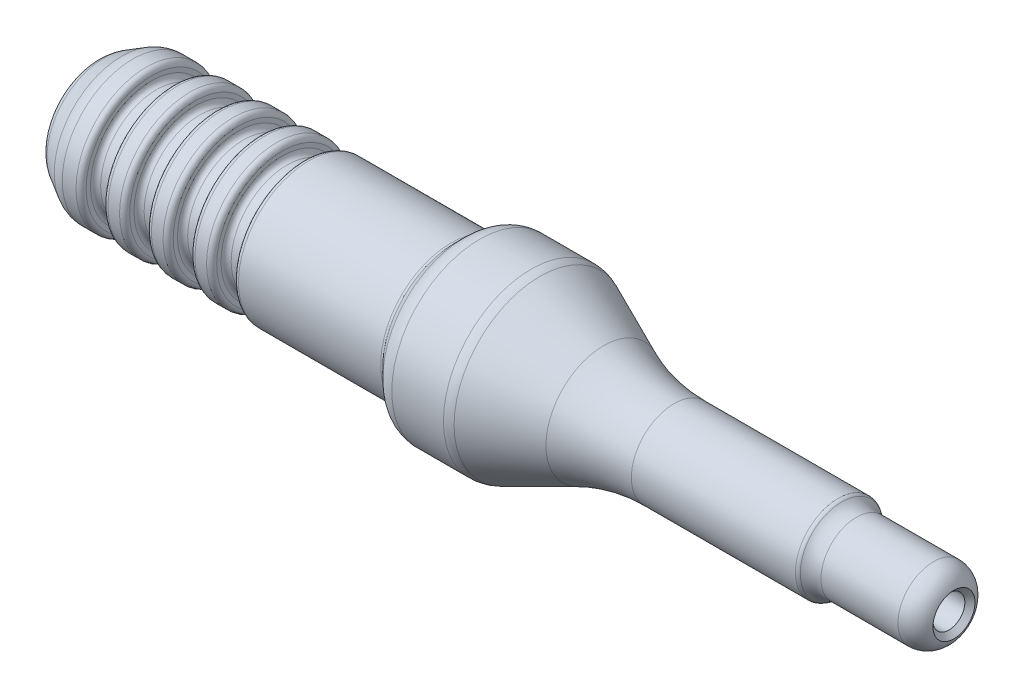
from build123d import *

# Parameters (mm, degrees)
RADYUS1_R = 12
PAH1_SIZE = 0.35
RADYUS2_R = 1.5
RADYUS3_R = 0.35


with BuildPart() as part:
    # Çizim1 → Döndür1 (revolve)
    with BuildSketch(Plane.XY, mode=Mode.PRIVATE) as d_nd_r1_sk:
        Polygon((0, 0), (0, 3.52), (2.2999999999999994, 4.847905619136144), (24.8, 4.847905619136145), (26, 6.047905619136151), (30.5, 6.047905619136152), (37.5, 2.9473941251088362), (51.5, 2.9473941251088362), (51.78717063202492, 2.45), (59.33717063202492, 2.45), (59.33717063202492, 0), align=None)
    revolve(d_nd_r1_sk.sketch.rotate(Axis((59.33717063202492, 0, 0), (-1, 0, 0)), 90), axis=Axis((59.33717063202492, 0, 0), (-1, 0, 0)))

    # Çizim2 → Kes-Döndür1 (revolve, cut)
    with BuildSketch(Plane.XY, mode=Mode.PRIVATE) as kes_d_nd_r1_sk:
        Polygon((0, 0), (0, 2.7), (33.5, 2.7), (36.2712812921102, 1.1), (59.33717063202492, 1.1), (59.33717063202492, 0), align=None)
        Polygon((7, 3.8499999999999925), (7, 4.8499999999999925), (8.5, 4.849999999999992), (8.5, 3.8499999999999925), align=None)
        Polygon((4, 3.8499999999999925), (5.5, 3.8499999999999925), (5.5, 4.849999999999992), (4, 4.8499999999999925), align=None)
        Polygon((10, 3.8499999999999925), (10, 4.8499999999999925), (11.5, 4.849999999999992), (11.5, 3.8499999999999925), align=None)
        Polygon((13.000000000000002, 3.8499999999999925), (13.000000000000002, 4.8499999999999925), (14.5, 4.849999999999992), (14.5, 3.8499999999999925), align=None)
    revolve(kes_d_nd_r1_sk.sketch.rotate(Axis((59.33717063202492, 0, 0), (-1, 0, 0)), 90), axis=Axis((59.33717063202492, 0, 0), (-1, 0, 0)), mode=Mode.SUBTRACT)

    # Radyus1
    radyus1_edges = [part.edges().sort_by_distance(p)[0] for p in [
        (37.5, -6.9e-16, 2.9473941251088362),
    ]]
    fillet(radyus1_edges, radius=RADYUS1_R)

    # Pah1
    pah1_edges = [part.edges().sort_by_distance(p)[0] for p in [
        (59.33717063202492, -2.6e-16, 1.1),
    ]]
    chamfer(pah1_edges, length=PAH1_SIZE)

    # Radyus2
    # the kernel refuses this fillet: 1.5 mm, written as the material it adds along each edge
    with BuildSketch(Plane(origin=(51.78717063202492, 0, 0), x_dir=(0, 1.1e-16, -1), z_dir=(0, 1, 1.1e-16))) as radyus2_piece_1:
        with BuildLine():
            CenterArc((3.95, -0.8285271136184704), RADYUS2_R, 131.94399752487033, 48.056002475129674)
            Line((2.9473941251088394, 0.28717063202491744), (2.927342007611016, 0.3094845869377849))
            ThreePointArc((2.927342007611016, 0.3094845869377849), (2.683697062554418, 0.1695660781259889), (2.4350000000000005, 0.02598076211353373))
            Line((2.4350000000000005, 0.02598076211353373), (2.4200000000000004, 0))
            Line((2.4200000000000004, 0), (2.4200000000000004, -0.8285271136184704))
            Line((2.4200000000000004, -0.8285271136184704), (2.45, -0.8285271136184704))
        make_face()
    revolve(axis=Axis((51.78717063202492, 0, 0), (-1, 0, 0)))
    # the kernel refuses this fillet: 1.5 mm, written as the material it takes off along each edge
    with BuildSketch(Plane(origin=(26, 0, 0), x_dir=(0, 1.1e-16, -1), z_dir=(0, 1, 1.1e-16))) as radyus2_2_piece_1:
        with BuildLine():
            CenterArc((6.047905619136151 - RADYUS2_R, -RADYUS2_R * 0.414213562373), RADYUS2_R, 0, 45.00000000000021)
            Line((6.047905619136151 - RADYUS2_R * 0.292893218813, RADYUS2_R * 0.292893218813), (6.047905619136151 - RADYUS2_R * 0.27875108319, RADYUS2_R * 0.307035354437))
            Line((6.047905619136151 - RADYUS2_R * 0.27875108319, RADYUS2_R * 0.307035354437), (6.047905619136151 + RADYUS2_R * 0.02, RADYUS2_R * 0.00828427124746))
            Line((6.047905619136151 + RADYUS2_R * 0.02, RADYUS2_R * 0.00828427124746), (6.047905619136151 + RADYUS2_R * 0.02, -RADYUS2_R * 0.414213562373))
            Line((6.047905619136151 + RADYUS2_R * 0.02, -RADYUS2_R * 0.414213562373), (6.047905619136151, -RADYUS2_R * 0.414213562373))
        make_face()
    revolve(axis=Axis((26, 0, 0), (-1, 0, 0)), mode=Mode.SUBTRACT)
    with BuildSketch(Plane(origin=(2.299999999999997, 0, 0), x_dir=(0, 1.1e-16, -1), z_dir=(0, 1, 1.1e-16))) as radyus2_2_piece_2:
        with BuildLine():
            CenterArc((4.847905619136144 - RADYUS2_R, -RADYUS2_R * 0.267949192431), RADYUS2_R, 1.696e-14, 30.000000000000057)
            Line((4.847905619136144, -RADYUS2_R * 0.267949192431), (4.847905619136144 + RADYUS2_R * 0.02, -RADYUS2_R * 0.267949192431))
            Line((4.847905619136144 + RADYUS2_R * 0.02, -RADYUS2_R * 0.267949192431), (4.847905619136144 + RADYUS2_R * 0.02, RADYUS2_R * 0.00535898384862))
            Line((4.847905619136144 + RADYUS2_R * 0.02, RADYUS2_R * 0.00535898384862), (4.847905619136144 - RADYUS2_R * 0.11665408814, RADYUS2_R * 0.242050807569))
            Line((4.847905619136144 - RADYUS2_R * 0.11665408814, RADYUS2_R * 0.242050807569), (4.847905619136144 - RADYUS2_R * 0.133974596216, RADYUS2_R * 0.232050807569))
        make_face()
    revolve(axis=Axis((2.299999999999997, 0, 0), (-1, 0, 0)), mode=Mode.SUBTRACT)
    with BuildSketch(Plane(origin=(0, 0, 0), x_dir=(0, 1.1e-16, -1), z_dir=(0, 1, 1.1e-16))) as radyus2_2_piece_3:
        with BuildLine():
            CenterArc((2.653559434569093, -1.4992809189349605), RADYUS2_R, 30.0000000000001, 58.22581755245369)
            Line((3.95259754024575, -0.7492809189349583), (3.978578302359283, -0.7342809189349583))
            Line((3.978578302359283, -0.7342809189349583), (3.5459807621135333, 0.01500000000000004))
            Line((3.5459807621135333, 0.01500000000000004), (3.52, 0.03))
            ThreePointArc((3.52, 0.03), (3.1100000000000003, 0.03), (2.7009288113086183, 0.02998561837869853))
            Line((2.7009288113086183, 0.02998561837869853), (2.7, -6.7e-16))
        make_face()
    revolve(axis=Axis((0, 0, 0), (-1, 0, 0)), mode=Mode.SUBTRACT)
    with BuildSketch(Plane(origin=(59.33717063202492, 0, 0), x_dir=(0, 1.1e-16, -1), z_dir=(0, 1, 1.1e-16))) as radyus2_2_piece_4:
        with BuildLine():
            CenterArc((0.9500000000000002, 1.4142135623730923), RADYUS2_R, 289.47122063449075, 70.52877936550924)
            Line((2.45, 1.4142135623730923), (2.48, 1.4142135623730923))
            Line((2.48, 1.4142135623730923), (2.48, 0))
            Line((2.48, 0), (2.45, -0.03000000000000114))
            ThreePointArc((2.45, -0.03000000000000114), (1.9500000000000006, -0.03000000000000114), (1.460000000000001, -0.02828427124746469))
            Line((1.460000000000001, -0.02828427124746469), (1.450000000000001, 0))
        make_face()
    revolve(axis=Axis((59.33717063202492, 0, 0), (-1, 0, 0)), mode=Mode.SUBTRACT)
    with BuildSketch(Plane(origin=(30.5, 0, 0), x_dir=(0, 1.1e-16, -1), z_dir=(0, 1, 1.1e-16))) as radyus2_2_piece_5:
        with BuildLine():
            CenterArc((6.047905619136152 - RADYUS2_R, RADYUS2_R * 0.211553464978), RADYUS2_R, 336.11, 23.88999999999998)
            Line((6.047905619136152, RADYUS2_R * 0.211553464978), (6.047905619136152 + RADYUS2_R * 0.02, RADYUS2_R * 0.211553464978))
            Line((6.047905619136152 + RADYUS2_R * 0.02, RADYUS2_R * 0.211553464978), (6.047905619136152 + RADYUS2_R * 0.02, -RADYUS2_R * 0.00423106929956))
            Line((6.047905619136152 + RADYUS2_R * 0.02, -RADYUS2_R * 0.00423106929956), (6.047905619136152 - RADYUS2_R * 0.0673888551076, -RADYUS2_R * 0.201528188479))
            Line((6.047905619136152 - RADYUS2_R * 0.0673888551076, -RADYUS2_R * 0.201528188479), (6.047905619136152 - RADYUS2_R * 0.0856753481447, -RADYUS2_R * 0.193428548215))
        make_face()
    revolve(axis=Axis((30.5, 0, 0), (-1, 0, 0)), mode=Mode.SUBTRACT)

    # Radyus3
    radyus3_edges = [part.edges().sort_by_distance(p)[0] for p in [
        (24.799999999999997, -1.13e-15, 4.847905619136145),
        (14.5, 6e-17, 4.847905619136144),
        (13, 6e-17, 4.847905619136144),
        (14.5, -9e-16, 3.8499999999999925),
        (13, -9e-16, 3.8499999999999925),
        (11.5, 6e-17, 4.847905619136144),
        (10, 6e-17, 4.847905619136144),
        (11.5, -9e-16, 3.8499999999999925),
        (10, -9e-16, 3.8499999999999925),
        (8.5, 6e-17, 4.847905619136144),
        (7, 6e-17, 4.847905619136144),
        (8.5, -9e-16, 3.8499999999999925),
        (7, -9e-16, 3.8499999999999925),
        (4, 6e-17, 4.847905619136144),
        (5.5, 6e-17, 4.847905619136144),
        (4, -9e-16, 3.8499999999999925),
        (5.5, -9e-16, 3.8499999999999925),
        (51.5, -6.9e-16, 2.9473941251088362),
    ]]
    fillet(radyus3_edges, radius=RADYUS3_R)


solid = part.part
